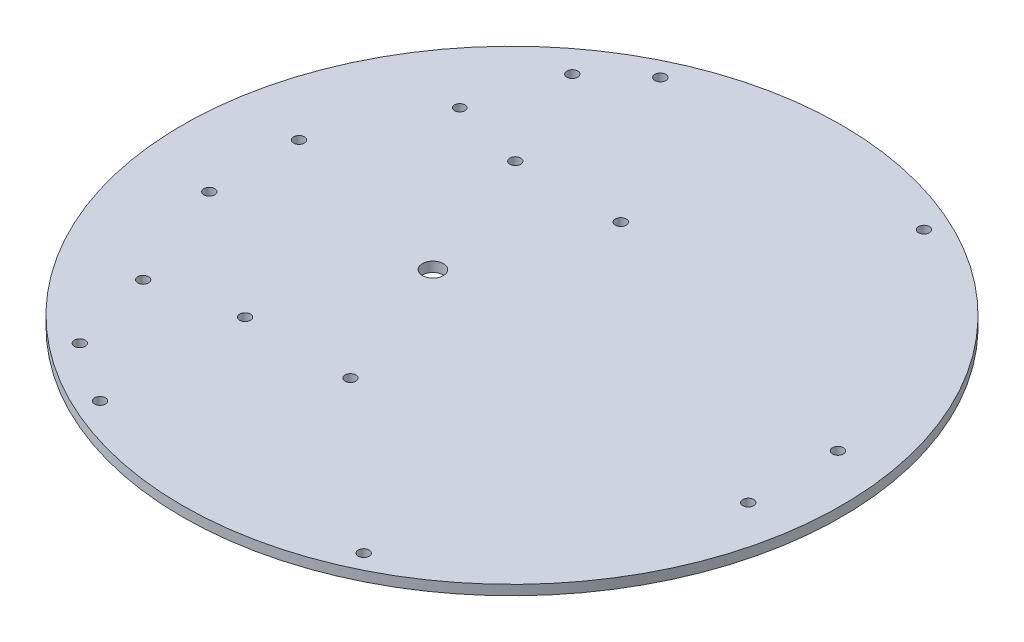
from build123d import *

# Parameters (mm, degrees)
CROQUIS1_R              = 100
CROQUIS1_R_2            = 1.65
CROQUIS1_R_3            = 3.175
CROQUIS1_R_4            = 1.559752628
SALIENTE_EXTRUIR1_DEPTH = 3


with BuildPart() as part:
    # Croquis1 → Saliente-Extruir1 (new body)
    with BuildSketch(Plane(origin=(0, 0, 0), x_dir=(1, 0, 0), z_dir=(0, 1, 0))):
        Circle(CROQUIS1_R)
        with Locations((40, -85)):
            Circle(CROQUIS1_R_2, mode=Mode.SUBTRACT)
        with Locations((40, 85)):
            Circle(CROQUIS1_R_2, mode=Mode.SUBTRACT)
        with Locations((-40, -85)):
            Circle(CROQUIS1_R_2, mode=Mode.SUBTRACT)
        with Locations((-40, 85)):
            Circle(CROQUIS1_R_2, mode=Mode.SUBTRACT)
        with Locations((-40, 41)):
            Circle(CROQUIS1_R_2, mode=Mode.SUBTRACT)
        with Locations((-40, -41)):
            Circle(CROQUIS1_R_2, mode=Mode.SUBTRACT)
        with Locations((-24, 0)):
            Circle(CROQUIS1_R_3, mode=Mode.SUBTRACT)
        with Locations((-8, 41)):
            Circle(CROQUIS1_R_2, mode=Mode.SUBTRACT)
        with Locations((-8, -41)):
            Circle(CROQUIS1_R_2, mode=Mode.SUBTRACT)
        with Locations((85.070235004, 13.824441517)):
            Circle(CROQUIS1_R_2, mode=Mode.SUBTRACT)
        with Locations((85.070235004, -13.375558483)):
            Circle(CROQUIS1_R_2, mode=Mode.SUBTRACT)
        with Locations((-54.227480628, 72.528357265)):
            Circle(CROQUIS1_R_2, mode=Mode.SUBTRACT)
        with Locations((-62.456735614, 46.603092322)):
            Circle(CROQUIS1_R_4, mode=Mode.SUBTRACT)
        with Locations((-78.396993978, 13.752324836)):
            Circle(CROQUIS1_R_2, mode=Mode.SUBTRACT)
        with Locations((-78.396993978, -13.447675164)):
            Circle(CROQUIS1_R_2, mode=Mode.SUBTRACT)
        with Locations((-65.278300678, -46.636121303)):
            Circle(CROQUIS1_R_2, mode=Mode.SUBTRACT)
        with Locations((-58.238422651, -72.909303778)):
            Circle(CROQUIS1_R_2, mode=Mode.SUBTRACT)
    extrude(amount=SALIENTE_EXTRUIR1_DEPTH)


solid = part.part
